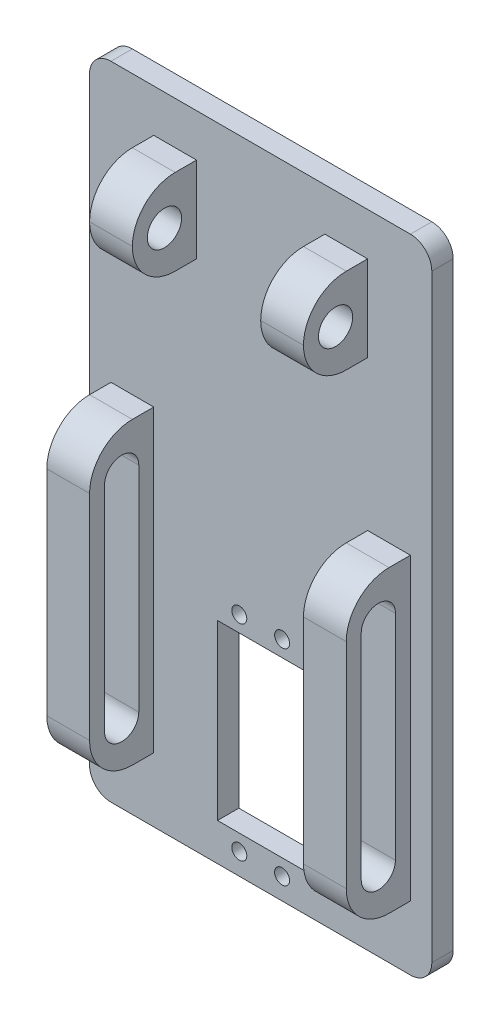
from build123d import *

# Parameters (mm, degrees)
SKETCH_1_R          = 1.75
SKETCH_1_W          = 20.2
SKETCH_1_H          = 40.5
EXTRUDE_1_DEPTH     = 5
SKETCH_2_W          = 10
SKETCH_2_H          = 20
SKETCH_2_H_2        = 70
EXTRUDE_2_DEPTH     = 15
SKETCH_3_R          = 4
CUT_EXTRUDE_1_DEPTH = 146
FILLET_1_R          = 10


with BuildPart() as part:
    # 草图1 → 凸台-拉伸1 (new body)
    with BuildSketch(Plane.XY):
        with BuildLine():
            Line((35, -75), (-35, -75))
            ThreePointArc((-35, -75), (-38.535533906, -73.535533906), (-40, -70))
            Line((-40, -70), (-40, 70))
            ThreePointArc((-40, 70), (-38.535533906, 73.535533906), (-35, 75))
            Line((-35, 75), (35, 75))
            ThreePointArc((35, 75), (38.535533906, 73.535533906), (40, 70))
            Line((40, 70), (40, -70))
            ThreePointArc((40, -70), (38.535533906, -73.535533906), (35, -75))
        make_face()
        with Locations((-5, -22)):
            Circle(SKETCH_1_R, mode=Mode.SUBTRACT)
        with Locations(Location((5, -22, 0), (0, 0, 180))):
            Circle(SKETCH_1_R, mode=Mode.SUBTRACT)
        with Locations((5, -70)):
            Circle(SKETCH_1_R, mode=Mode.SUBTRACT)
        with Locations(Location((-5, -70, 0), (0, 0, 180))):
            Circle(SKETCH_1_R, mode=Mode.SUBTRACT)
        with Locations((0, -46)):
            Rectangle(SKETCH_1_W, SKETCH_1_H, mode=Mode.SUBTRACT)
    extrude(amount=EXTRUDE_1_DEPTH)

    # 草图2 → 凸台-拉伸2 (add)
    with BuildSketch(Plane.XY.offset(5)):
        with Locations((20, 55)):
            Rectangle(SKETCH_2_W, SKETCH_2_H)
        with Locations((30, -25)):
            Rectangle(SKETCH_2_W, SKETCH_2_H_2)
        with Locations((-30, -25)):
            Rectangle(SKETCH_2_W, SKETCH_2_H_2)
        with Locations((-20, 55)):
            Rectangle(SKETCH_2_W, SKETCH_2_H)
    extrude(amount=EXTRUDE_2_DEPTH)

    # 草图3 → 切除-拉伸1 (cut)
    with BuildSketch(Plane.ZY.offset(35)):
        with Locations((12.5, 55)):
            Circle(SKETCH_3_R)
        with BuildLine():
            Line((8.5, -50), (8.5, 0))
            ThreePointArc((8.5, 0), (12.5, 4), (16.5, 0))
            Line((16.5, 0), (16.5, -50))
            ThreePointArc((16.5, -50), (12.5, -54), (8.5, -50))
        make_face()
    extrude(amount=-CUT_EXTRUDE_1_DEPTH, mode=Mode.SUBTRACT)

    # 圆角1
    fillet_1_edges = [part.edges().sort_by_distance(p)[0] for p in [
        (30, -60, 20),
        (-30, -60, 20),
        (30, 10, 20),
        (-30, 10, 20),
        (20, 45, 20),
        (20, 65, 20),
        (-20, 45, 20),
        (-20, 65, 20),
    ]]
    fillet(fillet_1_edges, radius=FILLET_1_R - 0.0001)  # a hair under: the kernel refuses the full size


solid = part.part
